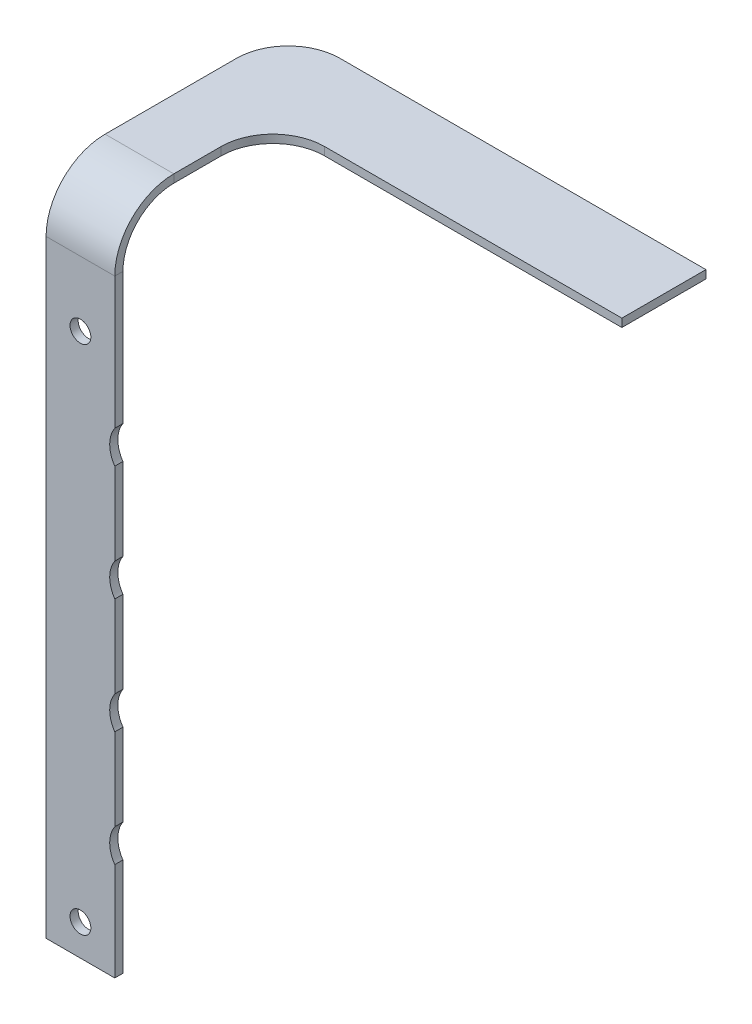
from build123d import *

# Parameters (mm, degrees)
SKETCH1_R                    = 2.0447
BOSS_EXTRUDE1_DEPTH          = 1.5
CONVERT_SOLID1_START         = -0.100000102
CONVERT_SOLID1_OUTLINE_R     = 2.0447
CONVERT_SOLID1_DEPTH         = 0.100000102
EDGE_FLANGE1_STRIP_W         = 26.400000408
EDGE_FLANGE1_STRIP_H         = 1.600000102
EDGE_FLANGE1_STRIP_CUT_DEPTH = 13.5
EDGE_FLANGE1_DEPTH           = 13.5
EDGE_FLANGE1_FLAT_DEPTH      = 1.600000102
CUT_EXTRUDE1_DEPTH           = 241.95509557
CUT_EXTRUDE1_DEPTH_BACK      = 3.81
SKETCH14_R                   = 6.583720687


# Read off the part's stored shape, not the designer's step: Convert-Solid1
# Sheet-metal steps are written as plain solids
with BuildPart() as part:
    # Sketch1 → Boss-Extrude1 (new body)
    with BuildSketch(Plane.XY):
        with BuildLine():
            Line((-183.376451986, -43.514598677), (-183.376451986, -62.800541688))
            Line((-183.376451986, -62.800541688), (-196.876451986, -62.800541688))
            Line((-196.876451986, -62.800541688), (-196.876451986, 68.254211442))
            Line((-196.876451986, 68.254211442), (-183.376451986, 68.254211442))
            Line((-183.376451986, 68.254211442), (-183.376451986, 47.120607659))
            Line((-183.376451986, 47.120607659), (-183.376451986, 40.670801349))
            Line((-183.376451986, 40.670801349), (-183.376451986, 30.753207577))
            ThreePointArc((-183.376451986, 30.753207577), (-184.376452018, 27.528304422), (-183.376451986, 24.303401267))
            Line((-183.376451986, 24.303401267), (-183.376451986, 8.147207521))
            ThreePointArc((-183.376451986, 8.147207521), (-184.376451986, 4.922304422), (-183.376451986, 1.697401323))
            Line((-183.376451986, 1.697401323), (-183.376451986, -14.458792479))
            ThreePointArc((-183.376451986, -14.458792479), (-184.376451986, -17.683695578), (-183.376451986, -20.908598677))
            Line((-183.376451986, -20.908598677), (-183.376451986, -37.064792479))
            ThreePointArc((-183.376451986, -37.064792479), (-184.376451986, -40.289695578), (-183.376451986, -43.514598677))
        make_face()
        with Locations((-190.126451986, -56.65709566)):
            Circle(SKETCH1_R, mode=Mode.SUBTRACT)
        with Locations((-190.126451986, 43.895704504)):
            Circle(SKETCH1_R, mode=Mode.SUBTRACT)
    extrude(amount=BOSS_EXTRUDE1_DEPTH)

    # Convert-Solid1 outline → Convert-Solid1 (add)
    with BuildSketch(Plane.XY.offset(CONVERT_SOLID1_START)):
        with BuildLine():
            Line((-183.376451986, -62.800541688), (-183.376451986, -43.514598677))
            ThreePointArc((-183.376451986, -43.514598677), (-184.376451986, -40.289695578), (-183.376451986, -37.064792479))
            Line((-183.376451986, -37.064792479), (-183.376451986, -20.908598677))
            ThreePointArc((-183.376451986, -20.908598677), (-184.376451986, -17.683695578), (-183.376451986, -14.458792479))
            Line((-183.376451986, -14.458792479), (-183.376451986, 1.697401323))
            ThreePointArc((-183.376451986, 1.697401323), (-184.376451986, 4.922304422), (-183.376451986, 8.147207521))
            Line((-183.376451986, 8.147207521), (-183.376451986, 24.303401267))
            ThreePointArc((-183.376451986, 24.303401267), (-184.376452018, 27.528304422), (-183.376451986, 30.753207577))
            Line((-183.376451986, 30.753207577), (-183.376451986, 68.254211442))
            Line((-183.376451986, 68.254211442), (-196.876451986, 68.254211442))
            Line((-196.876451986, 68.254211442), (-196.876451986, -62.800541688))
            Line((-196.876451986, -62.800541688), (-183.376451986, -62.800541688))
        make_face()
        with Locations((-190.126451986, -56.65709566)):
            Circle(CONVERT_SOLID1_OUTLINE_R, mode=Mode.SUBTRACT)
        with Locations((-190.126451986, 43.895704504)):
            Circle(CONVERT_SOLID1_OUTLINE_R, mode=Mode.SUBTRACT)
    extrude(amount=CONVERT_SOLID1_DEPTH)

    # Edge-Flange1 strip (across the edge) → Edge-Flange1 strip cut (cut)
    with BuildSketch(Plane(origin=(-196.876451986, 68.254211442, -0.100000102), x_dir=(0, -1, 0), z_dir=(1, 0, 0))):
        with Locations((-1.600000102, -0.800000051)):
            Rectangle(EDGE_FLANGE1_STRIP_W, EDGE_FLANGE1_STRIP_H)
    extrude(amount=EDGE_FLANGE1_STRIP_CUT_DEPTH, mode=Mode.SUBTRACT)

    # Edge-Flange1 bend section (across the edge) → Edge-Flange1 (add)
    with BuildSketch(Plane(origin=(-196.876451986, 68.254211442, -0.100000102), x_dir=(0, -1, 0), z_dir=(1, 0, 0))):
        with BuildLine():
            Line((0, 10), (1.600000102, 10))
            ThreePointArc((1.600000102, 10), (4.52893229, 2.928932188), (11.600000102, 0))
            Line((11.600000102, 0), (11.600000102, -1.600000102))
            ThreePointArc((11.600000102, -1.600000102), (3.397561368, 1.797561266), (0, 10))
        make_face()
    extrude(amount=EDGE_FLANGE1_DEPTH)

    # Edge-Flange1 profile (on flange) → Edge-Flange1 flat (add)
    with BuildSketch(Plane(origin=(0, 68.254211442, -0.100000102), x_dir=(1, 0, 0), z_dir=(0, 1, 0))):
        with BuildLine():
            Line((-196.876451986, 10), (-183.376451986, 10))
            Line((-183.376451986, 10), (-183.376451986, 19.305702381))
            ThreePointArc((-183.376451986, 19.305702381), (-180.400656883, 26.489907277), (-173.216451986, 29.465702381))
            Line((-173.216451986, 29.465702381), (-114.796451986, 29.465702381))
            Line((-114.796451986, 29.465702381), (-114.796451986, 45.983320267))
            Line((-114.796451986, 45.983320267), (-175.756451986, 45.983320267))
            Line((-175.756451986, 45.983320267), (-186.716451986, 45.983320267))
            ThreePointArc((-186.716451986, 45.983320267), (-193.900656883, 43.007525164), (-196.876451986, 35.823320267))
            Line((-196.876451986, 35.823320267), (-196.876451986, 10))
        make_face()
    extrude(amount=-EDGE_FLANGE1_FLAT_DEPTH)

    # Sketch14 → Cut-Extrude1 (cut, two sides: drawn at the far end of the back side and taken through both)
    with BuildSketch(Plane(origin=(0, 68.254211442, 0), x_dir=(1, 0, 0), z_dir=(0, 1, 0)).offset(-CUT_EXTRUDE1_DEPTH_BACK)):
        with Locations((-99.147079888, 65.798432199)):
            Circle(SKETCH14_R)
    extrude(amount=CUT_EXTRUDE1_DEPTH + CUT_EXTRUDE1_DEPTH_BACK, mode=Mode.SUBTRACT)


solid = part.part
